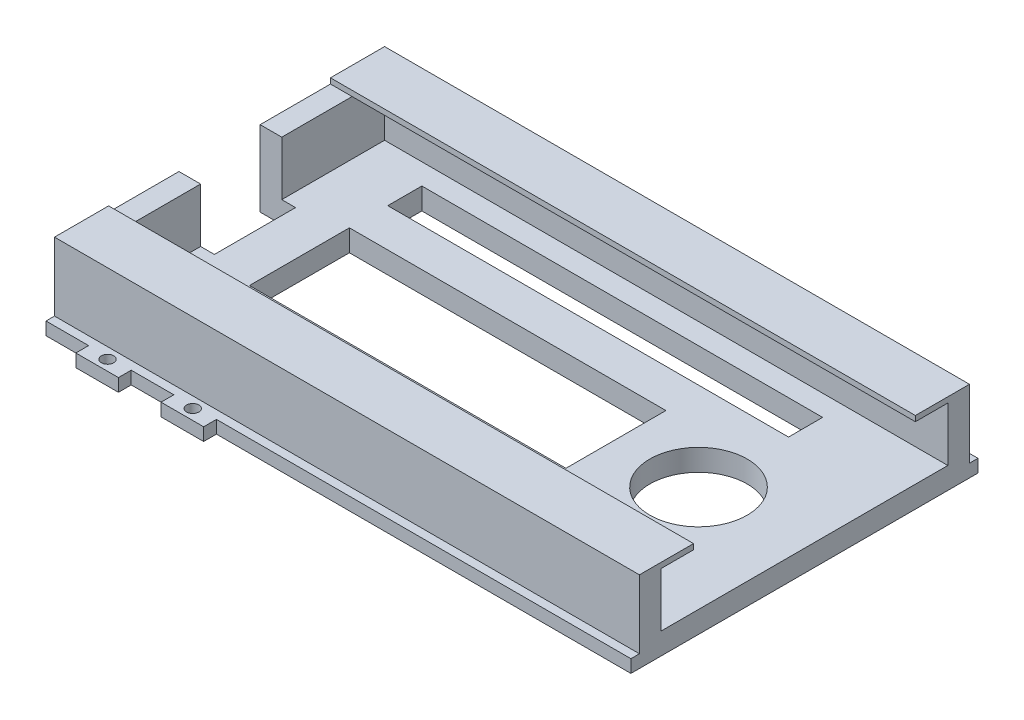
from build123d import *

# Parameters (mm, degrees)
SKETCH1_W           = 137.287
SKETCH1_H           = 77.47
BOSS_EXTRUDE1_DEPTH = 17.78
SKETCH2_W           = 132.207
SKETCH2_H           = 67.31
CUT_EXTRUDE1_DEPTH  = 12.7
SKETCH4_R           = 11.43
CUT_EXTRUDE2_DEPTH  = 80.834956737
SKETCH5_W           = 137.287
SKETCH5_H           = 12.7
BOSS_EXTRUDE2_DEPTH = 1.27
SKETCH6_W           = 8.314266468
SKETCH6_H           = 19.05
CUT_EXTRUDE3_DEPTH  = 81.798878193
SKETCH9_W           = 137.287
SKETCH9_H           = 2
SKETCH9_W_2         = 10
SKETCH9_H_2         = 3
BOSS_EXTRUDE4_DEPTH = 3
SKETCH10_R          = 1.44
CUT_EXTRUDE4_DEPTH  = 84.591762855
SKETCH11_W          = 74.289701227
SKETCH11_H          = 23.47
SKETCH11_W_2        = 94.06956823
SKETCH11_H_2        = 8
CUT_EXTRUDE5_DEPTH  = 10


with BuildPart() as part:
    # Sketch1 → Boss-Extrude1 (new body)
    with BuildSketch(Plane(origin=(0, 0, 0), x_dir=(1, 0, 0), z_dir=(0, 1, 0))):
        Rectangle(SKETCH1_W, SKETCH1_H)
    extrude(amount=BOSS_EXTRUDE1_DEPTH)

    # Sketch2 → Cut-Extrude1 (cut)
    with BuildSketch(Plane(origin=(0, 17.78, 0), x_dir=(1, 0, 0), z_dir=(0, 1, 0))):
        with Locations((2.54, 0)):
            Rectangle(SKETCH2_W, SKETCH2_H)
    extrude(amount=-CUT_EXTRUDE1_DEPTH, mode=Mode.SUBTRACT)

    # Sketch4 → Cut-Extrude2 (cut, through all)
    with BuildSketch(Plane(origin=(0, 5.08, 0), x_dir=(1, 0, 0), z_dir=(0, 1, 0))):
        with Locations((43.7769, 0)):
            Circle(SKETCH4_R)
    extrude(amount=-CUT_EXTRUDE2_DEPTH, mode=Mode.SUBTRACT)

    # Sketch5 → Boss-Extrude2 (add)
    with BuildSketch(Plane(origin=(0, 17.78, 0), x_dir=(1, 0, 0), z_dir=(0, 1, 0))):
        with Locations((0, 32.385)):
            Rectangle(SKETCH5_W, SKETCH5_H)
        with Locations((0, -32.385)):
            Rectangle(SKETCH5_W, SKETCH5_H)
    extrude(amount=BOSS_EXTRUDE2_DEPTH)

    # Sketch6 → Cut-Extrude3 (cut, through all)
    with BuildSketch(Plane(origin=(0, 17.78, 0), x_dir=(1, 0, 0), z_dir=(0, 1, 0))):
        with Locations((-64.486366766, 0)):
            Rectangle(SKETCH6_W, SKETCH6_H)
    extrude(amount=-CUT_EXTRUDE3_DEPTH, mode=Mode.SUBTRACT)

    # Sketch9 → Boss-Extrude4 (add)
    with BuildSketch(Plane(origin=(0, 0, 0), x_dir=(-1, 0, 0), z_dir=(0, -1, 0))):
        with Locations((0, -39.735)):
            Rectangle(SKETCH9_W, SKETCH9_H)
        with Locations((0, 39.735)):
            Rectangle(SKETCH9_W, SKETCH9_H)
        with Locations((53.6435, -42.235)):
            Rectangle(SKETCH9_W_2, SKETCH9_H_2)
        with Locations((53.6435, 42.235)):
            Rectangle(SKETCH9_W_2, SKETCH9_H_2)
        with Locations((33.6435, -42.235)):
            Rectangle(SKETCH9_W_2, SKETCH9_H_2)
        with Locations((33.6435, 42.235)):
            Rectangle(SKETCH9_W_2, SKETCH9_H_2)
    extrude(amount=-BOSS_EXTRUDE4_DEPTH)

    # Sketch10 → Cut-Extrude4 (cut, through all)
    with BuildSketch(Plane(origin=(0, 0, 0), x_dir=(-1, 0, 0), z_dir=(0, -1, 0))):
        with Locations((33.6435, -41.295)):
            Circle(SKETCH10_R)
        with Locations((53.6435, -41.295)):
            Circle(SKETCH10_R)
        with Locations((53.6435, 41.295)):
            Circle(SKETCH10_R)
        with Locations((33.6435, 41.295)):
            Circle(SKETCH10_R)
    extrude(amount=-CUT_EXTRUDE4_DEPTH, mode=Mode.SUBTRACT)

    # Sketch11 → Cut-Extrude5 (cut)
    with BuildSketch(Plane.XZ):
        with Locations((-12.752728003, 0)):
            Rectangle(SKETCH11_W, SKETCH11_H)
        with Locations((-2.862794502, 24.735)):
            Rectangle(SKETCH11_W_2, SKETCH11_H_2)
        with Locations((-2.862794502, -24.735)):
            Rectangle(SKETCH11_W_2, SKETCH11_H_2)
    extrude(amount=-CUT_EXTRUDE5_DEPTH, mode=Mode.SUBTRACT)


solid = part.part
